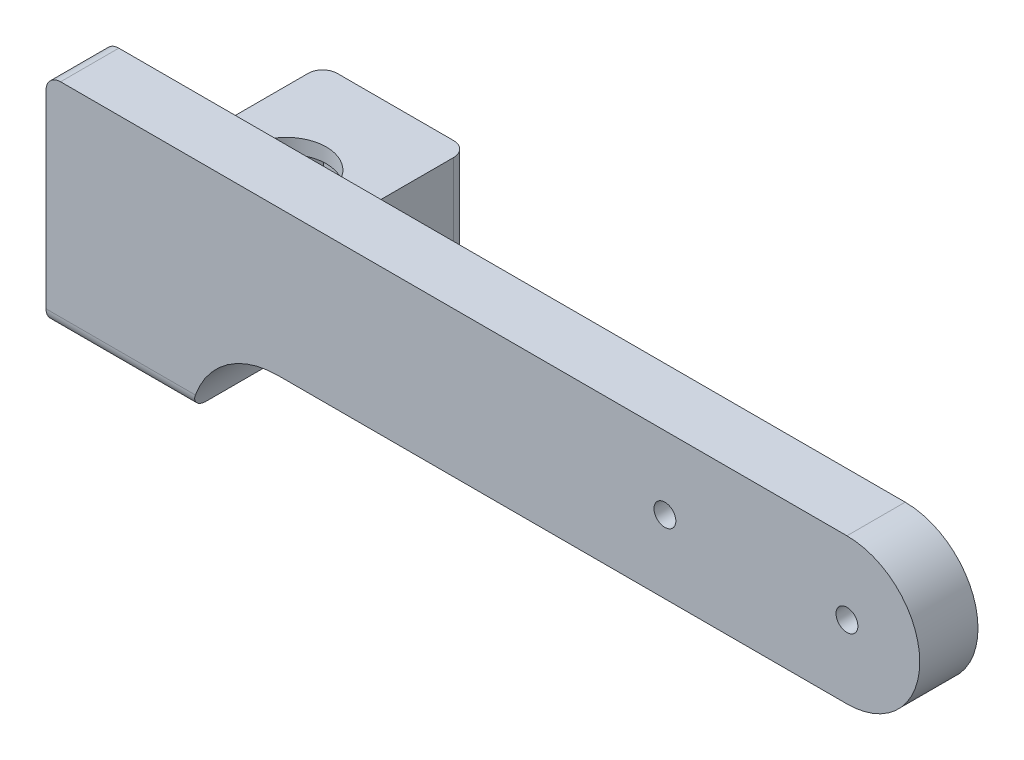
from build123d import *

# Parameters (mm, degrees)
BOSS_EXTRUDE1_DEPTH      = 8
SKETCH2_R                = 1.5
CUT_EXTRUDE1_DEPTH       = 10
BOSS_EXTRUDE3_DEPTH      = 30
BOSS_EXTRUDE3_DEPTH_BACK = 8
SKETCH6_W                = 20
SKETCH6_H                = 10
FILLET3_R                = 12
SKETCH7_W                = 20
SKETCH7_H                = 30
BOSS_EXTRUDE4_DEPTH      = 2
CUT_EXTRUDE3_DEPTH       = 10
SKETCH9_R                = 5.5
CUT_EXTRUDE4_DEPTH       = 10
FILLET4_R                = 5
FILLET5_R                = 2
SKETCH10_R               = 1.5
CUT_EXTRUDE5_DEPTH       = 10


with BuildPart() as part:
    # Sketch1 → Boss-Extrude1 (new body)
    with BuildSketch(Plane.XY):
        with BuildLine():
            Line((-25, 10), (85, 10))
            ThreePointArc((85, 10), (95, 0), (85, -10))
            Line((85, -10), (-25, -10))
            Line((-25, -10), (-25, 10))
        make_face()
    extrude(amount=BOSS_EXTRUDE1_DEPTH)

    # Sketch2 → Cut-Extrude1 (cut)
    with BuildSketch(Plane.XY.offset(8)):
        with Locations((85, 0)):
            Circle(SKETCH2_R)
    extrude(amount=-CUT_EXTRUDE1_DEPTH, mode=Mode.SUBTRACT)

    # Sketch6 → Boss-Extrude3 (add, two sides: drawn at the far end of the back side and taken through both)
    with BuildSketch(Plane(origin=(0, 0, 0), x_dir=(-1, 0, 0), z_dir=(0, 0, -1)).offset(-BOSS_EXTRUDE3_DEPTH_BACK)):
        with Locations((15, -15)):
            Rectangle(SKETCH6_W, SKETCH6_H)
    extrude(amount=BOSS_EXTRUDE3_DEPTH + BOSS_EXTRUDE3_DEPTH_BACK)

    # Fillet3
    # the kernel refuses this fillet: 12 mm, written as the material it adds along each edge
    with BuildSketch(Plane(origin=(-5, -10, 8), x_dir=(0, -1, 0), z_dir=(0, 0, -1))) as fillet3_piece_1:
        with BuildLine():
            CenterArc((12, -11.832159566), FILLET3_R, 99.594068227, 80.405931773)
            Line((0, -11.832159566), (0, 0))
            Line((0, 0), (10, 0))
        make_face()
    extrude(amount=8)

    # Sketch7 → Boss-Extrude4 (add)
    with BuildSketch(Plane(origin=(0, -10, 0), x_dir=(1, 0, 0), z_dir=(0, 1, 0))):
        with Locations((-15, 15)):
            Rectangle(SKETCH7_W, SKETCH7_H)
    extrude(amount=BOSS_EXTRUDE4_DEPTH)

    # Sketch8 → Cut-Extrude3 (cut)
    with BuildSketch(Plane.XZ.offset(20)):
        Polygon((-12.092828782, -7.012612723), (-20.463694682, -8.488622233), (-23.370865901, -16.47600951), (-17.907171218, -22.987387277), (-9.536305318, -21.511377767), (-6.629134099, -13.52399049), align=None)
    extrude(amount=-CUT_EXTRUDE3_DEPTH, mode=Mode.SUBTRACT)

    # Sketch9 → Cut-Extrude4 (cut)
    with BuildSketch(Plane.XZ.offset(10)):
        with Locations(Location((-15, -15, 0), (0, 0, 270))):
            Circle(SKETCH9_R)
    extrude(amount=-CUT_EXTRUDE4_DEPTH, mode=Mode.SUBTRACT)

    # Fillet4
    # the kernel refuses this fillet: 5 mm, written as the material it adds along each edge
    with BuildSketch(Plane(origin=(-5, -20, 0), x_dir=(1, 0, 0), z_dir=(0, 1, 0))) as fillet4_piece_1_section:
        with BuildLine():
            CenterArc((FILLET4_R, FILLET4_R), FILLET4_R, 180, 90)
            Line((0, FILLET4_R), (0, 0))
            Line((0, 0), (FILLET4_R, 0))
        make_face()
    fillet4_piece_1 = extrude(amount=12, mode=Mode.PRIVATE)
    fillet4_piece_1 = fillet4_piece_1 - Plane(origin=(6.832159566, -22, 0), x_dir=(0, -1, 0), z_dir=(0, 0, 1)) * Cylinder(12, 44, mode=Mode.PRIVATE)
    add(fillet4_piece_1)
    with BuildSketch(Plane(origin=(-25, -8, 0), x_dir=(0, 1, 0), z_dir=(1, 0, 0))) as fillet4_piece_2:
        with BuildLine():
            CenterArc((FILLET4_R, -FILLET4_R), FILLET4_R, 90, 90)
            Line((0, -FILLET4_R), (0, 0))
            Line((0, 0), (FILLET4_R, 0))
        make_face()
    extrude(amount=20)
    with BuildSketch(Plane(origin=(-5, -20, 0), x_dir=(1, 0, 0), z_dir=(0, 1, 0))) as fillet4_piece_3a_section:
        with BuildLine():
            CenterArc((FILLET4_R, FILLET4_R), FILLET4_R, 180, 90)
            Line((0, FILLET4_R), (0, 0))
            Line((0, 0), (FILLET4_R, 0))
        make_face()
    fillet4_piece_3a = extrude(amount=24.5, mode=Mode.PRIVATE)
    fillet4_piece_3a = split(fillet4_piece_3a, bisect_by=Plane(origin=(-5, -8, 0), z_dir=(0, 1, 0)), keep=Keep.TOP, mode=Mode.PRIVATE)
    with BuildSketch(Plane(origin=(-25, -8, 0), x_dir=(0, 1, 0), z_dir=(1, 0, 0))) as fillet4_piece_3b_section:
        with BuildLine():
            CenterArc((FILLET4_R, -FILLET4_R), FILLET4_R, 90, 90)
            Line((0, -FILLET4_R), (0, 0))
            Line((0, 0), (FILLET4_R, 0))
        make_face()
    fillet4_piece_3b = extrude(amount=32.5, mode=Mode.PRIVATE)
    fillet4_piece_3b = split(fillet4_piece_3b, bisect_by=Plane(origin=(-5, -8, 0), z_dir=(1, 0, 0)), keep=Keep.TOP, mode=Mode.PRIVATE)
    fillet4_piece_3 = fillet4_piece_3a & fillet4_piece_3b
    add(fillet4_piece_3)

    # Fillet5
    fillet5_edges = [part.edges().sort_by_distance(p)[0] for p in [
        (-15, -20, 8),
        (-25, -14, -30),
        (-5, -14, -30),
        (-25, 10, 4),
    ]]
    fillet(fillet5_edges, radius=FILLET5_R)

    # Sketch10 → Cut-Extrude5 (cut)
    with BuildSketch(Plane.XY.offset(8)):
        with Locations((60, 0)):
            Circle(SKETCH10_R)
    extrude(amount=-CUT_EXTRUDE5_DEPTH, mode=Mode.SUBTRACT)


solid = part.part
